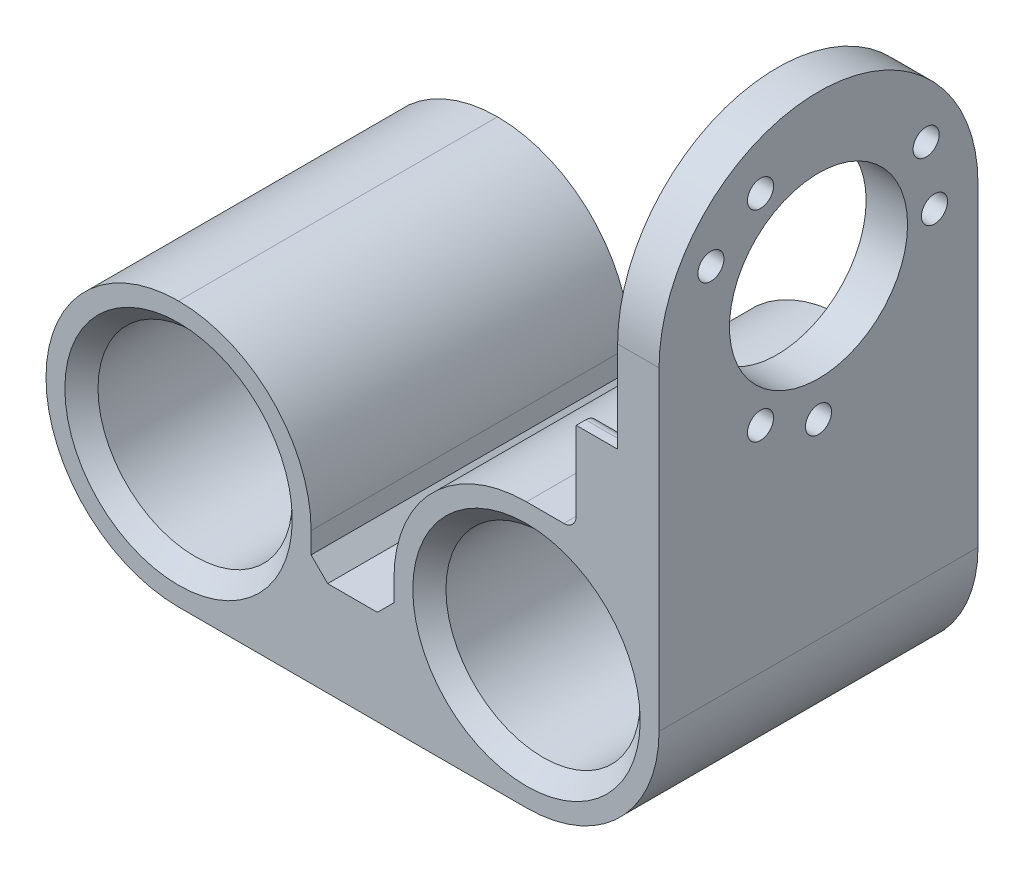
from build123d import *

# Parameters (mm, degrees)
SKETCH1_W               = 74
SKETCH1_H               = 32
SKETCH1_R               = 11.725
BOSS_EXTRUDE1_DEPTH     = 38.5
SKETCH2_R               = 1.575
SKETCH2_R_2             = 10.75
BOSS_EXTRUDE2_DEPTH     = 5
BOSS_EXTRUDE3_DEPTH     = 5
CUT_EXTRUDE1_DEPTH      = 112.012668196
CUT_EXTRUDE1_DEPTH_BACK = 112.012668196
SKETCH4_W               = 10
SKETCH4_H               = 25
SKETCH4_H_2             = 4.450035805
CUT_EXTRUDE2_DEPTH      = 104.814669361
CUT_EXTRUDE2_DEPTH_BACK = 8
SKETCH5_R               = 1.525
FILLET8_R               = 16
FILLET9_R               = 1.5
FILLET10_SIZE           = 2


with BuildPart() as part:
    # Sketch1 → Boss-Extrude1 (new body)
    with BuildSketch(Plane.XY):
        with Locations((37, 16)):
            Rectangle(SKETCH1_W, SKETCH1_H)
        with Locations((16, 16)):
            Circle(SKETCH1_R, mode=Mode.SUBTRACT)
        with Locations((58, 16)):
            Circle(SKETCH1_R, mode=Mode.SUBTRACT)
    extrude(amount=BOSS_EXTRUDE1_DEPTH)

    # Sketch2 → Boss-Extrude2 (add)
    with BuildSketch(Plane(origin=(74, 0, 0), x_dir=(0, 0, -1), z_dir=(1, 0, 0))):
        with BuildLine():
            Line((-38.5, 32), (0, 32))
            Line((0, 32), (0, 54))
            ThreePointArc((0, 54), (-19.25, 73.25), (-38.5, 54))
            Line((-38.5, 54), (-38.5, 32))
        make_face()
        with Locations((-6.259618943, 61.5)):
            Circle(SKETCH2_R, mode=Mode.SUBTRACT)
        with Locations((-26.25, 41.875644347)):
            Circle(SKETCH2_R, mode=Mode.SUBTRACT)
        with Locations((-32.240381057, 61.5)):
            Circle(SKETCH2_R, mode=Mode.SUBTRACT)
        with Locations((-26.25, 66.124355653)):
            Circle(SKETCH2_R, mode=Mode.SUBTRACT)
        with Locations((-19.25, 39)):
            Circle(SKETCH2_R, mode=Mode.SUBTRACT)
        with Locations((-19.25, 54)):
            Circle(SKETCH2_R_2, mode=Mode.SUBTRACT)
        with Locations((-5.25, 54)):
            Circle(SKETCH2_R, mode=Mode.SUBTRACT)
    extrude(amount=-BOSS_EXTRUDE2_DEPTH)

    # Sketch3 → Boss-Extrude3 (add)
    with BuildSketch(Plane.ZY.offset(-69)):
        with BuildLine():
            Line((0, 43), (0, 32))
            Line((0, 32), (38.5, 32))
            Line((38.5, 32), (38.5, 43))
            Line((38.5, 43), (36.548843892, 43))
            ThreePointArc((36.548843892, 43), (19.25, 33.5), (1.951156108, 43))
            Line((1.951156108, 43), (0, 43))
        make_face()
    extrude(amount=BOSS_EXTRUDE3_DEPTH)

    # Sketch4 → Cut-Extrude1 (cut, two sides: drawn at the far end of the back side and taken through both)
    with BuildSketch(Plane(origin=(0, 0, 0), x_dir=(-1, 0, 0), z_dir=(0, 0, -1)).offset(-CUT_EXTRUDE1_DEPTH_BACK)):
        with Locations((-37, 23.950035805)):
            Rectangle(SKETCH4_W, SKETCH4_H)
        with Locations((-37, 34.225017902)):
            Rectangle(SKETCH4_W, SKETCH4_H_2)
    extrude(amount=CUT_EXTRUDE1_DEPTH + CUT_EXTRUDE1_DEPTH_BACK, mode=Mode.SUBTRACT)

    # Sketch5 → Cut-Extrude2 (cut, two sides: drawn at the far end of the back side and taken through both)
    with BuildSketch(Plane(origin=(0, 11.450035805, 0), x_dir=(1, 0, 0), z_dir=(0, 1, 0)).offset(-CUT_EXTRUDE2_DEPTH_BACK)):
        with Locations(Location((37, -19.25, 0), (0, 0, 90))):
            Circle(SKETCH5_R)
    extrude(amount=CUT_EXTRUDE2_DEPTH + CUT_EXTRUDE2_DEPTH_BACK, mode=Mode.SUBTRACT)

    # Fillet8
    fillet8_edges = [part.edges().sort_by_distance(p)[0] for p in [
        (42, 32, 19.25),
        (32, 32, 19.25),
        (0, 32, 19.25),
        (0, 0, 19.25),
        (74, 0, 19.25),
    ]]
    fillet(fillet8_edges, radius=FILLET8_R - 0.0001)  # a hair under: the kernel refuses the full size

    # Fillet9
    fillet9_edges = [part.edges().sort_by_distance(p)[0] for p in [
        (66.5, 43, 36.548843892),
        (66.5, 43, 1.951156108),
        (64, 32, 19.25),
    ]]
    fillet(fillet9_edges, radius=FILLET9_R - 0.0001)  # a hair under: the kernel refuses the full size

    # Fillet10
    fillet10_edges = [part.edges().sort_by_distance(p)[0] for p in [
        (4.275, 16, 0),
        (4.275, 16, 38.5),
        (46.275, 16, 0),
        (46.275, 16, 38.5),
        (42, 11.450035805, 19.25),
        (32, 11.450035805, 19.25),
    ]]
    chamfer(fillet10_edges, length=FILLET10_SIZE)


solid = part.part
